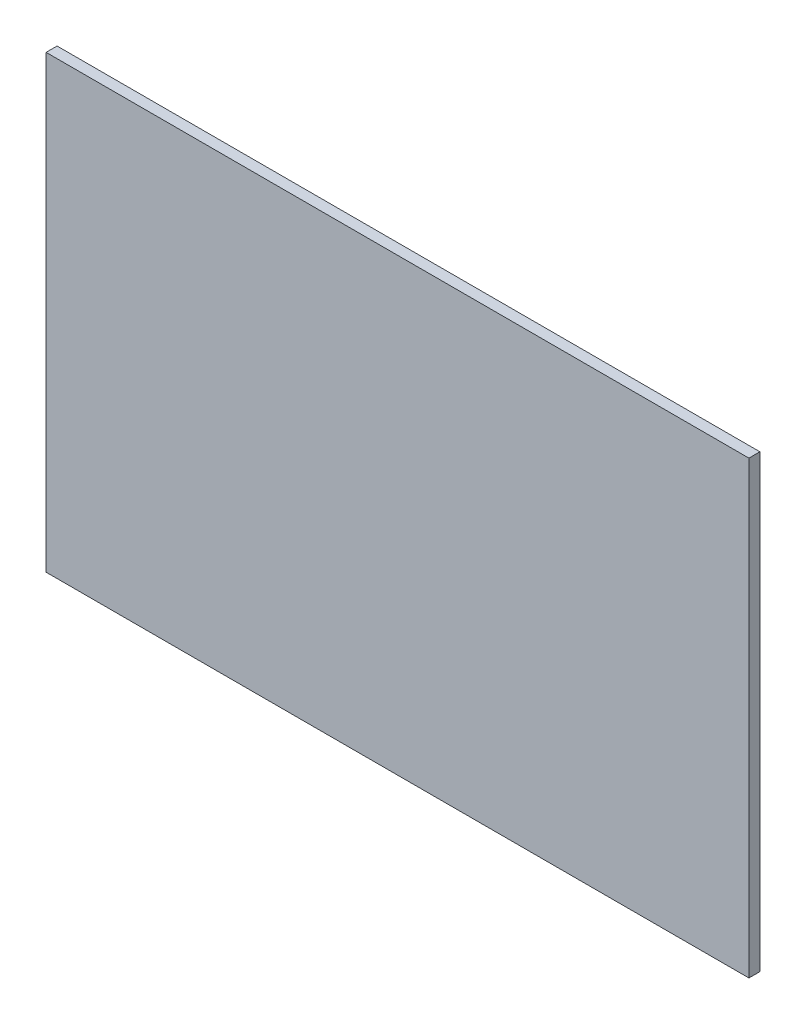
from build123d import *

# Parameters (mm, degrees)
SKETCH1_W          = 320
SKETCH1_H          = 205
BASE_FLANGE1_DEPTH = 5


# Sheet-metal steps are written as plain solids
with BuildPart() as part:
    # Sketch1 → Base-Flange1 (new body)
    with BuildSketch(Plane.XY):
        Rectangle(SKETCH1_W, SKETCH1_H)
    extrude(amount=-BASE_FLANGE1_DEPTH)


solid = part.part
